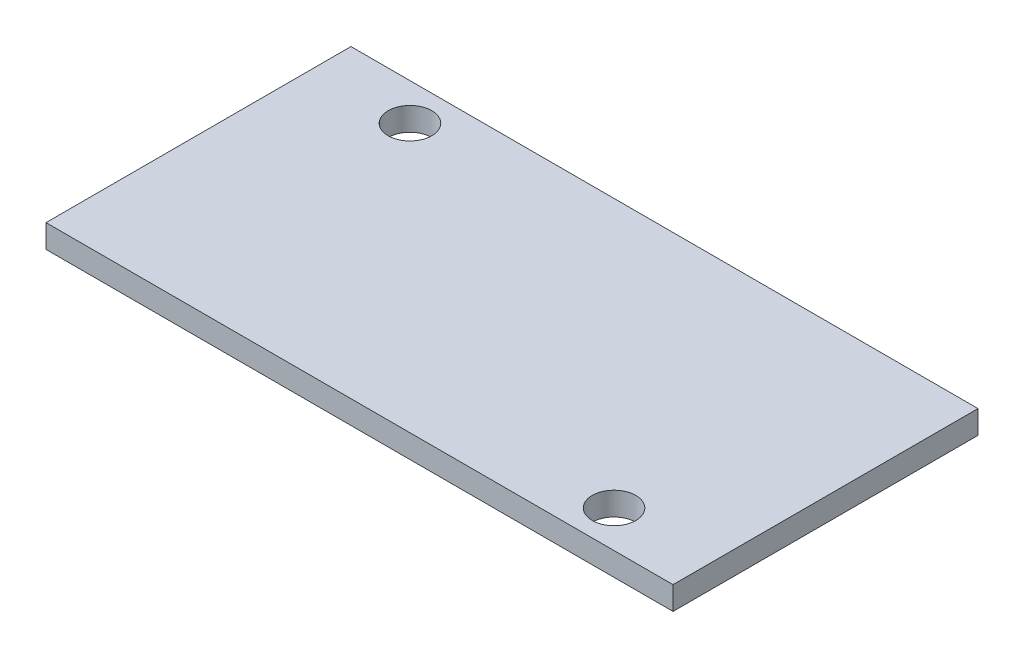
from build123d import *

# Parameters (mm, degrees)
SKETCH_1_W          = 43.18
SKETCH_1_H          = 21
EXTRUDE_1_DEPTH     = 1.6
SKETCH_2_R          = 1.5
CUT_EXTRUDE_1_DEPTH = 10


with BuildPart() as part:
    # 草图1 → 凸台-拉伸1 (new body)
    with BuildSketch(Plane(origin=(0, 0, 0), x_dir=(1, 0, 0), z_dir=(0, 1, 0))):
        Rectangle(SKETCH_1_W, SKETCH_1_H)
    extrude(amount=EXTRUDE_1_DEPTH)

    # 草图2 → 切除-拉伸1 (cut)
    with BuildSketch(Plane(origin=(0, 1.6, 0), x_dir=(1, 0, 0), z_dir=(0, 1, 0))):
        with Locations((-14.986, 7.96)):
            Circle(SKETCH_2_R)
        with Locations((14.986, -7.96)):
            Circle(SKETCH_2_R)
    extrude(amount=-CUT_EXTRUDE_1_DEPTH, mode=Mode.SUBTRACT)


solid = part.part
